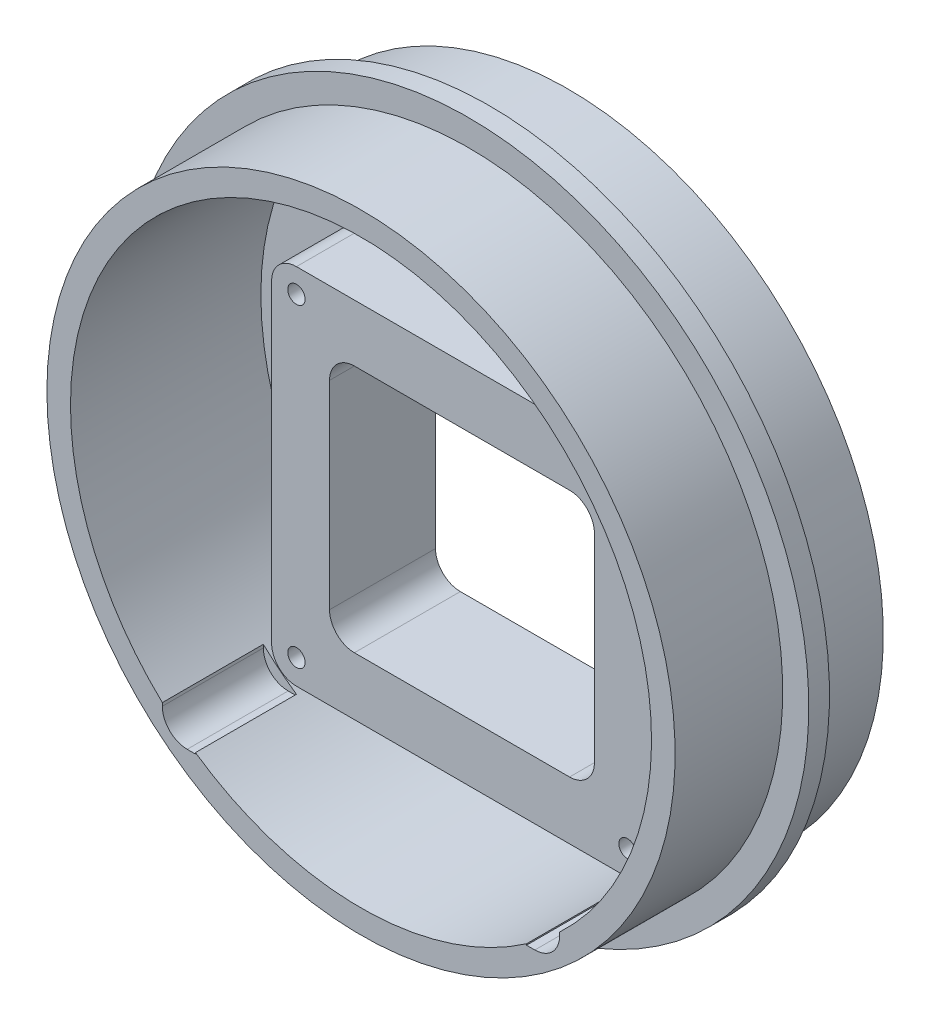
from build123d import *

# Parameters (mm, degrees)
BOSS_EXTRUDE1_DEPTH     = 10.8
CUT_EXTRUDE1_DEPTH      = 63.509359299
CUT_EXTRUDE1_DEPTH_BACK = 63.509359299
SKETCH14_W              = 32
SKETCH14_H              = 30
CUT_EXTRUDE3_DEPTH      = 60.51688836
FILLET1_R               = 3
SKETCH16_R              = 1.05
CUT_EXTRUDE2_DEPTH      = 10


with BuildPart() as part:
    # Sketch6 → Revolve1 (revolve)
    with BuildSketch(Plane(origin=(0, 0, 0), x_dir=(0, 0, -1), z_dir=(1, 0, 0))):
        Polygon((-2, 25.4), (-2, 35.1), (-25, 35.1), (-25, 37.95), (-12, 37.95), (-12, 41.1), (-9.5, 41.1), (-9.5, 38.1), (0, 38.1), (0, 25.4), (0, 0), (-2, 0), align=None)
    revolve(axis=Axis((0, 0, 0), (0, 0, 1)))

    # Sketch15 → Boss-Extrude1 (add)
    with BuildSketch(Plane.XY.offset(2)):
        with BuildLine():
            Line((-20, 15.904297927), (20, 15.904297927))
            ThreePointArc((20, 15.904297927), (22.121320344, 15.02561827), (23, 12.904297927))
            Line((23, 12.904297927), (23, -24.995702073))
            ThreePointArc((23, -24.995702073), (22.121320344, -27.117022417), (20, -27.995702073))
            Line((20, -27.995702073), (-20, -27.995702073))
            ThreePointArc((-20, -27.995702073), (-22.121320344, -27.117022417), (-23, -24.995702073))
            Line((-23, -24.995702073), (-23, 12.904297927))
            ThreePointArc((-23, 12.904297927), (-22.121320344, 15.02561827), (-20, 15.904297927))
        make_face()
    extrude(amount=BOSS_EXTRUDE1_DEPTH)

    # Sketch14 → Cut-Extrude1 (cut, two sides: drawn at the far end of the back side and taken through both)
    with BuildSketch(Plane.XY.offset(2).offset(-CUT_EXTRUDE1_DEPTH_BACK)):
        with Locations((-0.00164643, -5.995702073)):
            Rectangle(SKETCH14_W, SKETCH14_H)
    extrude(amount=CUT_EXTRUDE1_DEPTH + CUT_EXTRUDE1_DEPTH_BACK, mode=Mode.SUBTRACT)

    # Sketch18 → Cut-Extrude3 (cut, through all)
    with BuildSketch(Plane.XY.offset(12.8)):
        with BuildLine():
            Line((19.99835357, -24.995702073), (23.99835357, -24.995702073))
            Line((23.99835357, -24.995702073), (23.99835357, -25.995702073))
            ThreePointArc((23.99835357, -25.995702073), (23.119673914, -28.117022417), (20.99835357, -28.995702073))
            Line((20.99835357, -28.995702073), (19.99835357, -28.995702073))
            Line((19.99835357, -28.995702073), (19.99835357, -24.995702073))
        make_face()
        with BuildLine():
            Line((-20.00164643, -24.995702073), (-24.00164643, -24.995702073))
            Line((-24.00164643, -24.995702073), (-24.00164643, -25.995702073))
            ThreePointArc((-24.00164643, -25.995702073), (-23.122966774, -28.117022417), (-21.00164643, -28.995702073))
            Line((-21.00164643, -28.995702073), (-20.00164643, -28.995702073))
            Line((-20.00164643, -28.995702073), (-20.00164643, -24.995702073))
        make_face()
    extrude(amount=CUT_EXTRUDE3_DEPTH, mode=Mode.SUBTRACT)

    # Fillet1
    fillet1_edges = [part.edges().sort_by_distance(p)[0] for p in [
        (15.99835357, -20.995702073, 6.4),
        (-16.00164643, -20.995702073, 6.4),
        (15.99835357, 9.004297927, 6.4),
        (-16.00164643, 9.004297927, 6.4),
    ]]
    fillet(fillet1_edges, radius=FILLET1_R)

    # Sketch16 → Cut-Extrude2 (cut)
    with BuildSketch(Plane.XY.offset(12.8)):
        with Locations((-20.00164643, 13.004297927)):
            Circle(SKETCH16_R)
        with Locations((-20.00164643, -24.995702073)):
            Circle(SKETCH16_R)
        with Locations((19.99835357, -24.995702073)):
            Circle(SKETCH16_R)
        with Locations((19.99835357, 13.004297927)):
            Circle(SKETCH16_R)
    extrude(amount=-CUT_EXTRUDE2_DEPTH, mode=Mode.SUBTRACT)


solid = part.part
